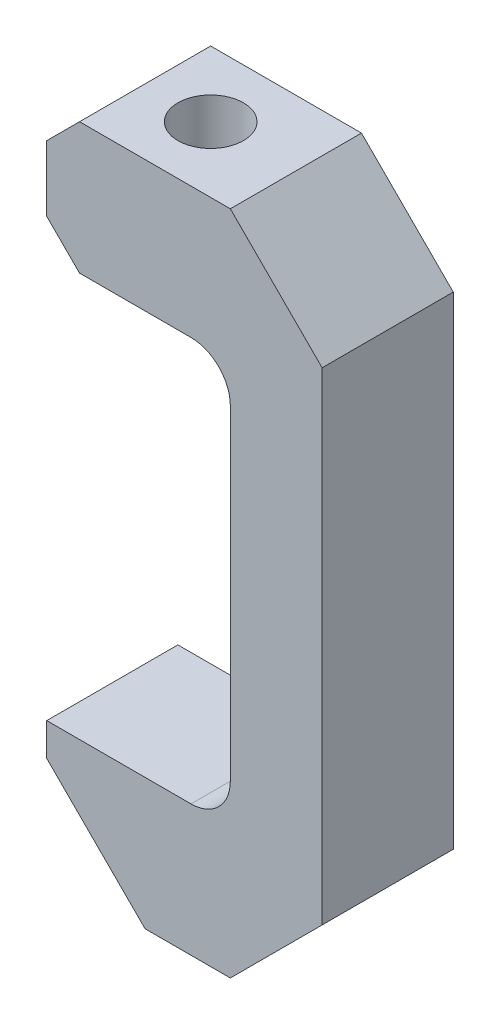
from build123d import *

# Parameters (mm, degrees)
BOSS_EXTRUDE1_DEPTH = 20
SKETCH2_R           = 5
CUT_EXTRUDE4_DEPTH  = 52
FILLET3_R           = 6


with BuildPart() as part:
    # Sketch1 → Boss-Extrude1 (new body)
    with BuildSketch(Plane.XY):
        Polygon((-14, -14), (0, 0), (0, 73.6), (-14, 87.6), (-37, 87.6), (-42, 82.6), (-42, 72.6), (-37, 67.6), (-14, 67.6), (-14, 6), (-42, 6), (-42, 1), (-27, -14), align=None)
    extrude(amount=BOSS_EXTRUDE1_DEPTH)

    # Sketch2 → Cut-Extrude4 (cut)
    with BuildSketch(Plane(origin=(0, 87.6, 0), x_dir=(1, 0, 0), z_dir=(0, 1, 0))):
        with Locations((-27, -10)):
            Circle(SKETCH2_R)
    extrude(amount=-CUT_EXTRUDE4_DEPTH, mode=Mode.SUBTRACT)

    # Fillet3
    fillet3_edges = [part.edges().sort_by_distance(p)[0] for p in [
        (-14, 6, 10),
        (-14, 67.6, 10),
    ]]
    fillet(fillet3_edges, radius=FILLET3_R)


solid = part.part
